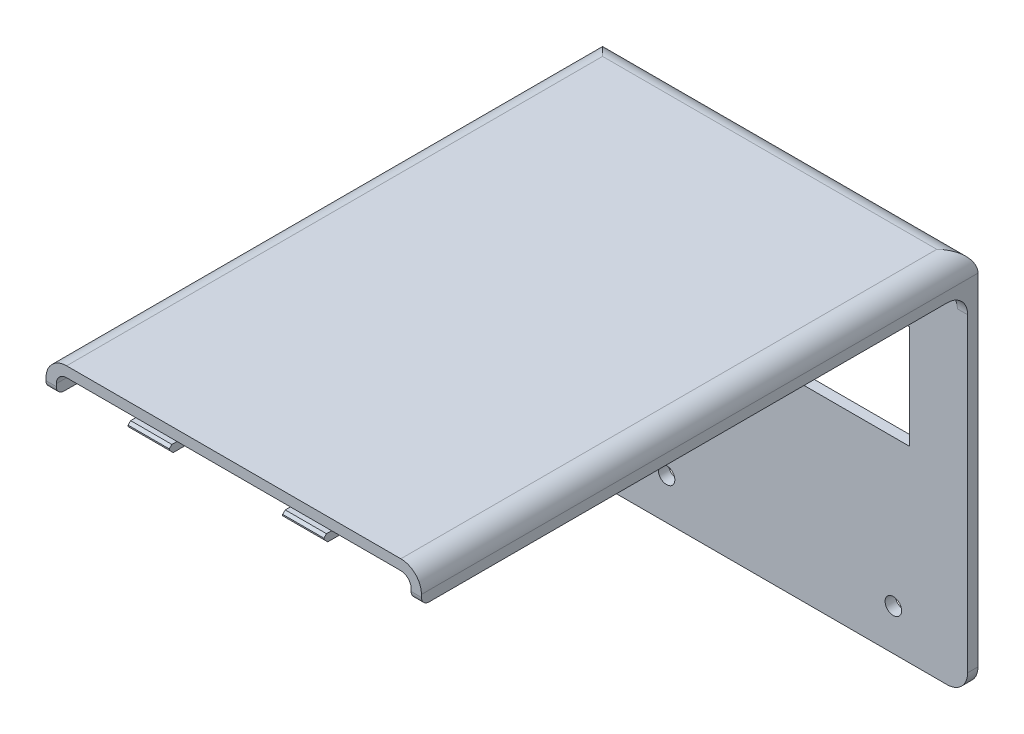
from build123d import *

# Parameters (mm, degrees)
SKETCH1_W                = 68.85
SKETCH1_H                = 107
BOSS_EXTRUDE1_DEPTH      = 2
SKETCH2_W                = 68.85
SKETCH2_H                = 2
BOSS_EXTRUDE2_DEPTH      = 67
CUT_EXTRUDE2_REACH       = 132.855
SKETCH5_W                = 68.85
SKETCH5_H                = 2
BOSS_EXTRUDE3_DEPTH      = 51
SKETCH6_W                = 68.85
SKETCH6_H                = 2
BOSS_EXTRUDE4_DEPTH      = 20.36
BOSS_EXTRUDE5_DEPTH      = 1.5
SKETCH13_W               = 2
SKETCH13_H               = 1.5
BOSS_EXTRUDE8_DEPTH      = 3
CUT_EXTRUDE4_REACH       = 97.75
SKETCH9_R                = 1.75
FILLET1_R                = 1.5
FILLET2_R                = 3
FILLET3_R                = 1.5
FILLET4_R                = 3
CUT_EXTRUDE5_REACH       = 111.975
SKETCH10_R               = 1.75
CHAMFER1_SIZE            = 2
SKETCH11_W               = 2
SKETCH11_H               = 109
BOSS_EXTRUDE6_DEPTH      = 4.5
SKETCH14_W               = 68.85
SKETCH14_H               = 0.5
BOSS_EXTRUDE9_DEPTH      = 2
FILLET5_R                = 2
FILLET6_R                = 4
FILLET8_R                = 4
CUT_EXTRUDE6_DEPTH       = 1
CUT_EXTRUDE7_DEPTH       = 125.986967721
SKETCH17_W               = 68.85
SKETCH17_H               = 2
BOSS_EXTRUDE10_DEPTH     = 8.66
SKETCH18_W               = 2
SKETCH18_H               = 68.16
BOSS_EXTRUDE11_DEPTH     = 2
SKETCH19_W               = 2
SKETCH19_H               = 68.16
BOSS_EXTRUDE12_DEPTH     = 2
FILLET9_R                = 4
FILLET10_R               = 4
FILLET11_R               = 1.5
BOSS_EXTRUDE13_START     = -2
BOSS_EXTRUDE13_OUTLINE_R = 1.6
BOSS_EXTRUDE13_DEPTH     = 2
BOSS_EXTRUDE14_START     = 15
SKETCH21_W               = 7.5
SKETCH21_H               = 1.5
BOSS_EXTRUDE14_DEPTH     = 4
CHAMFER2_SIZE            = 0.5
CHAMFER3_SIZE            = 0.75


# Read off the part's stored shape, not the designer's step: Boss-Extrude13
with BuildPart() as part:
    # Sketch1 → Boss-Extrude1 (new body)
    with BuildSketch(Plane(origin=(0, 0, 0), x_dir=(1, 0, 0), z_dir=(0, 1, 0))):
        Rectangle(SKETCH1_W, SKETCH1_H)
    extrude(amount=BOSS_EXTRUDE1_DEPTH)

    # Sketch2 → Boss-Extrude2 (add)
    with BuildSketch(Plane.XZ):
        with Locations((0, -52.5)):
            Rectangle(SKETCH2_W, SKETCH2_H)
    extrude(amount=BOSS_EXTRUDE2_DEPTH)

    # Sketch4 → Cut-Extrude2 (cut, up to next)
    with BuildSketch(Plane(origin=(0, 0, -53.5), x_dir=(-1, 0, 0), z_dir=(0, 0, -1)), mode=Mode.PRIVATE) as cut_extrude2_sk1:
        Polygon((-6.85, -15.65), (-6.85, -20.95), (-5.325, -20.95), (6.85, -20.95), (6.85, -15.65), (25.15, -15.65), (25.15, -35.75), (-25.15, -35.75), (-25.15, -15.65), align=None)
    cut_extrude2_tool1 = extrude(cut_extrude2_sk1.sketch, amount=-CUT_EXTRUDE2_REACH, mode=Mode.PRIVATE) & part.part
    add(cut_extrude2_tool1.solids().sort_by_distance((0, -26.272573, -53.5))[0], mode=Mode.SUBTRACT)

    # Sketch5 → Boss-Extrude3 (add)
    with BuildSketch(Plane.XY.offset(-51.5)):
        with Locations((0, -66)):
            Rectangle(SKETCH5_W, SKETCH5_H)
    extrude(amount=BOSS_EXTRUDE3_DEPTH)

    # Sketch6 → Boss-Extrude4 (add)
    with BuildSketch(Plane.XZ.offset(67)):
        with Locations((0, -1.5)):
            Rectangle(SKETCH6_W, SKETCH6_H)
    extrude(amount=BOSS_EXTRUDE4_DEPTH)

    # Sketch8 → Boss-Extrude5 (add)
    with BuildSketch(Plane(origin=(0, 2, 0), x_dir=(1, 0, 0), z_dir=(0, 1, 0))):
        Polygon((-36.425, 50.5), (-34.425, 50.5), (-34.425, -53.5), (34.425, -53.5), (34.425, 50.5), (36.425, 50.5), (36.425, -55.5), (-36.425, -55.5), align=None)
    extrude(amount=-BOSS_EXTRUDE5_DEPTH)

    # Sketch13 → Boss-Extrude8 (add)
    with BuildSketch(Plane(origin=(0, 0, -50.5), x_dir=(-1, 0, 0), z_dir=(0, 0, -1))):
        with Locations((35.425, 1.25)):
            Rectangle(SKETCH13_W, SKETCH13_H)
        with Locations((-35.425, 1.25)):
            Rectangle(SKETCH13_W, SKETCH13_H)
    extrude(amount=BOSS_EXTRUDE8_DEPTH)

    # Sketch9 → Cut-Extrude4 (cut, up to next)
    with BuildSketch(Plane.XZ.offset(67), mode=Mode.PRIVATE) as cut_extrude4_sk1:
        with Locations(Location((-25, -23.48, 0), (0, 0, 270))):
            Circle(SKETCH9_R)
    cut_extrude4_tool1 = extrude(cut_extrude4_sk1.sketch, amount=-CUT_EXTRUDE4_REACH, mode=Mode.PRIVATE) & part.part
    # Sketch9 → Cut-Extrude4 (cut, up to next)
    with BuildSketch(Plane.XZ.offset(67), mode=Mode.PRIVATE) as cut_extrude4_sk2:
        with Locations(Location((25, -23.48, 0), (0, 0, 270))):
            Circle(SKETCH9_R)
    cut_extrude4_tool2 = extrude(cut_extrude4_sk2.sketch, amount=-CUT_EXTRUDE4_REACH, mode=Mode.PRIVATE) & part.part
    add(cut_extrude4_tool1.solids().sort_by_distance((-25, -67, -23.48))[0], mode=Mode.SUBTRACT)
    add(cut_extrude4_tool2.solids().sort_by_distance((25, -67, -23.48))[0], mode=Mode.SUBTRACT)

    # Fillet1
    fillet1_edges = [part.edges().sort_by_distance(p)[0] for p in [
        (0, -67, -2.5),
    ]]
    fillet(fillet1_edges, radius=FILLET1_R)

    # Fillet2
    fillet2_edges = [part.edges().sort_by_distance(p)[0] for p in [
        (0, -65, -0.5),
    ]]
    fillet(fillet2_edges, radius=FILLET2_R)

    # Fillet3
    fillet3_edges = [part.edges().sort_by_distance(p)[0] for p in [
        (0, -65, -51.5),
    ]]
    fillet(fillet3_edges, radius=FILLET3_R)

    # Fillet4
    fillet4_edges = [part.edges().sort_by_distance(p)[0] for p in [
        (0, -67, -53.5),
    ]]
    fillet(fillet4_edges, radius=FILLET4_R)

    # Sketch10 → Cut-Extrude5 (cut, up to next)
    with BuildSketch(Plane.XY.offset(-0.5), mode=Mode.PRIVATE) as cut_extrude5_sk1:
        with Locations((-24.425, -79.36)):
            Circle(SKETCH10_R)
    cut_extrude5_tool1 = extrude(cut_extrude5_sk1.sketch, amount=-CUT_EXTRUDE5_REACH, mode=Mode.PRIVATE) & part.part
    # Sketch10 → Cut-Extrude5 (cut, up to next)
    with BuildSketch(Plane.XY.offset(-0.5), mode=Mode.PRIVATE) as cut_extrude5_sk2:
        with Locations((24.425, -79.36)):
            Circle(SKETCH10_R)
    cut_extrude5_tool2 = extrude(cut_extrude5_sk2.sketch, amount=-CUT_EXTRUDE5_REACH, mode=Mode.PRIVATE) & part.part
    add(cut_extrude5_tool1.solids().sort_by_distance((-24.425, -79.36, -0.5))[0], mode=Mode.SUBTRACT)
    add(cut_extrude5_tool2.solids().sort_by_distance((24.425, -79.36, -0.5))[0], mode=Mode.SUBTRACT)

    # Chamfer1
    chamfer1_edges = [part.edges().sort_by_distance(p)[0] for p in [
        (-34.425, -87.36, -1.5),
        (34.425, -87.36, -1.5),
    ]]
    chamfer(chamfer1_edges, length=CHAMFER1_SIZE)

    # Sketch11 → Boss-Extrude6 (add)
    with BuildSketch(Plane.XZ.offset(-0.5)):
        with Locations((35.425, 1)):
            Rectangle(SKETCH11_W, SKETCH11_H)
        with Locations((-35.425, 1)):
            Rectangle(SKETCH11_W, SKETCH11_H)
    extrude(amount=BOSS_EXTRUDE6_DEPTH)

    # Sketch14 → Boss-Extrude9 (add)
    with BuildSketch(Plane.XY.offset(53.5)):
        with Locations((0, 0.25)):
            Rectangle(SKETCH14_W, SKETCH14_H)
    extrude(amount=BOSS_EXTRUDE9_DEPTH)

    # Fillet5
    fillet5_edges = [part.edges().sort_by_distance(p)[0] for p in [
        (0, 0, -51.5),
        (34.425, 0, 2),
        (-34.425, 0, 2),
    ]]
    fillet(fillet5_edges, radius=FILLET5_R)

    # Fillet6
    fillet6_edges = [part.edges().sort_by_distance(p)[0] for p in [
        (0, 2, -53.5),
    ]]
    fillet(fillet6_edges, radius=FILLET6_R)

    # Fillet8
    # the kernel refuses this fillet: 4 mm, written as the material it takes off along each edge
    with BuildSketch(Plane(origin=(-36.425, 2, 65.5), x_dir=(1, 0, 0), z_dir=(0, 0, -1))) as fillet8_piece_1:
        with BuildLine():
            CenterArc((FILLET8_R, FILLET8_R), FILLET8_R, 180, 90)
            Line((0, FILLET8_R), (0, 0))
            Line((0, 0), (FILLET8_R, 0))
        make_face()
    extrude(amount=125, mode=Mode.SUBTRACT)
    with BuildSketch(Plane(origin=(36.425, 2, -59.5), x_dir=(0, -1, 0), z_dir=(0, 0, 1))) as fillet8_piece_2:
        with BuildLine():
            CenterArc((FILLET8_R, -FILLET8_R), FILLET8_R, 90, 90)
            Line((0, -FILLET8_R), (0, 0))
            Line((0, 0), (FILLET8_R, 0))
        make_face()
    extrude(amount=125, mode=Mode.SUBTRACT)

    # Sketch15 → Cut-Extrude6 (cut)
    with BuildSketch(Plane.XY.offset(55.5)):
        with BuildLine():
            Line((-36.425, -2), (-36.425, -4))
            Line((-36.425, -4), (-34.425, -4))
            Line((-34.425, -4), (-34.425, -2))
            ThreePointArc((-34.425, -2), (-33.839213562, -0.585786438), (-32.425, 0))
            Line((-32.425, 0), (32.425, 0))
            ThreePointArc((32.425, 0), (33.839213562, -0.585786438), (34.425, -2))
            Line((34.425, -2), (34.425, -4))
            Line((34.425, -4), (36.425, -4))
            Line((36.425, -4), (36.425, -2))
            ThreePointArc((36.425, -2), (35.253427125, 0.828427125), (32.425, 2))
            Line((32.425, 2), (-32.425, 2))
            ThreePointArc((-32.425, 2), (-35.253427125, 0.828427125), (-36.425, -2))
        make_face()
    extrude(amount=-CUT_EXTRUDE6_DEPTH, mode=Mode.SUBTRACT)

    # Sketch16 → Cut-Extrude7 (cut, through all)
    with BuildSketch(Plane(origin=(34.425, 0, 0), x_dir=(0, 0, -1), z_dir=(1, 0, 0))):
        with BuildLine():
            Line((2.5, -87.36), (0.5, -87.36))
            Line((0.5, -87.36), (0.5, -68))
            ThreePointArc((0.5, -68), (1.378679656, -65.878679656), (3.5, -65))
            Line((3.5, -65), (50, -65))
            ThreePointArc((50, -65), (51.060660172, -64.560660172), (51.5, -63.5))
            Line((51.5, -63.5), (53.5, -63.5))
            Line((53.5, -63.5), (53.5, -64))
            ThreePointArc((53.5, -64), (52.621320344, -66.121320344), (50.5, -67))
            Line((50.5, -67), (4, -67))
            ThreePointArc((4, -67), (2.939339828, -67.439339828), (2.5, -68.5))
            Line((2.5, -68.5), (2.5, -87.36))
        make_face()
    extrude(amount=-CUT_EXTRUDE7_DEPTH, mode=Mode.SUBTRACT)

    # Sketch17 → Boss-Extrude10 (add)
    with BuildSketch(Plane.XZ.offset(63.5)):
        with Locations((0, -52.5)):
            Rectangle(SKETCH17_W, SKETCH17_H)
    extrude(amount=BOSS_EXTRUDE10_DEPTH)

    # Sketch18 → Boss-Extrude11 (add)
    with BuildSketch(Plane(origin=(34.425, 0, 0), x_dir=(0, 0, -1), z_dir=(1, 0, 0))):
        with Locations((52.5, -38.08)):
            Rectangle(SKETCH18_W, SKETCH18_H)
    extrude(amount=BOSS_EXTRUDE11_DEPTH)

    # Sketch19 → Boss-Extrude12 (add)
    with BuildSketch(Plane.ZY.offset(34.425)):
        with Locations((-52.5, -38.08)):
            Rectangle(SKETCH19_W, SKETCH19_H)
    extrude(amount=BOSS_EXTRUDE12_DEPTH)

    # Fillet9
    fillet9_edges = [part.edges().sort_by_distance(p)[0] for p in [
        (36.425, -72.16, -52.5),
        (-36.425, -72.16, -52.5),
    ]]
    fillet(fillet9_edges, radius=FILLET9_R)

    # Fillet10
    fillet10_edges = [part.edges().sort_by_distance(p)[0] for p in [
        (35.425, -4, -51.5),
        (-35.425, -4, -51.5),
    ]]
    fillet(fillet10_edges, radius=FILLET10_R)

    # Fillet11
    fillet11_edges = [part.edges().sort_by_distance(p)[0] for p in [
        (35.425, -4, 54.5),
        (-35.425, -4, 54.5),
    ]]
    fillet(fillet11_edges, radius=FILLET11_R)

    # Boss-Extrude13 outline → Boss-Extrude13 (cut)
    with BuildSketch(Plane(origin=(0, 0, -53.5), x_dir=(-1, 0, 0), z_dir=(0, 0, -1)).offset(BOSS_EXTRUDE13_START)):
        with Locations((22, -64.16)):
            Circle(BOSS_EXTRUDE13_OUTLINE_R)
        with Locations((-22, -64.16)):
            Circle(BOSS_EXTRUDE13_OUTLINE_R)
    extrude(amount=BOSS_EXTRUDE13_DEPTH, mode=Mode.SUBTRACT)

    # Sketch21 → Boss-Extrude14 (add, symmetric)
    with BuildSketch(Plane(origin=(0, 0, 0), x_dir=(0, 0, -1), z_dir=(1, 0, 0)).offset(BOSS_EXTRUDE14_START)):
        with Locations((-52.25, -0.75)):
            Rectangle(SKETCH21_W, SKETCH21_H)
    boss_extrude14 = extrude(amount=BOSS_EXTRUDE14_DEPTH, both=True)

    # Mirror1: Boss-Extrude14 across plane
    add(boss_extrude14.mirror(Plane(origin=(0, 0, 0), x_dir=(0, 0, 1), z_dir=(1, 0, 0))))

    # Chamfer2
    chamfer2_edges = [part.edges().sort_by_distance(p)[0] for p in [
        (15, 0, 56),
        (-15, 0, 56),
    ]]
    chamfer(chamfer2_edges, length=CHAMFER2_SIZE)

    # Chamfer3
    chamfer3_edges = [part.edges().sort_by_distance(p)[0] for p in [
        (15, -1.5, 56),
        (-15, -1.5, 56),
    ]]
    chamfer(chamfer3_edges, length=CHAMFER3_SIZE)


solid = part.part
